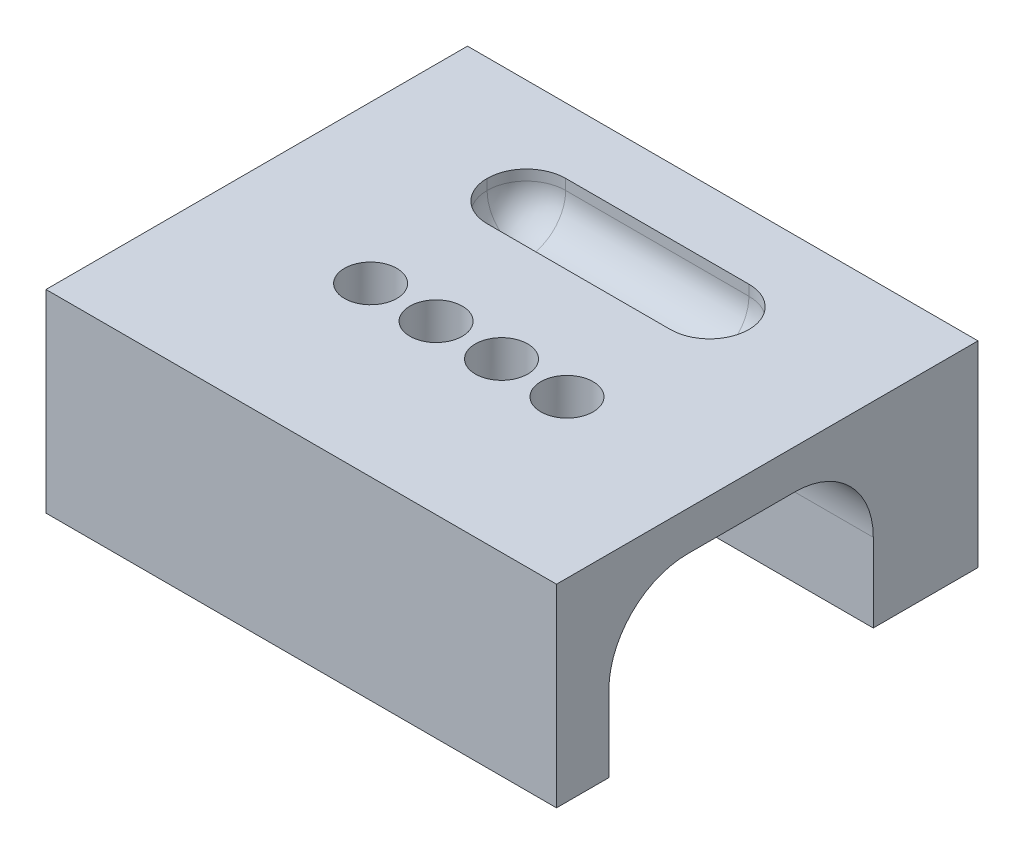
from build123d import *

# Parameters (mm, degrees)
BOSS_EXTRUDE1_DEPTH      = 4.44
BOSS_EXTRUDE1_DEPTH_BACK = 6
SKETCH21_W               = 19.5
SKETCH21_H               = 24
CUT_EXTRUDE2_DEPTH       = 24.71192527
CUT_EXTRUDE2_DEPTH_BACK  = 24.71192527
SKETCH14_R               = 1
CUT_EXTRUDE4_DEPTH       = 23.650882985
CUT_EXTRUDE4_DEPTH_BACK  = 23.650882985
SKETCH20_W               = 31.709739698
SKETCH20_H               = 13.674781638
SKETCH23_W               = 10
SKETCH23_H               = 3
CUT_EXTRUDE5_DEPTH       = 1.9
FILLET1_R                = 1.5
FILLET2_R                = 1.5


with BuildPart() as part:
    # Sketch21 → Boss-Extrude1 (new, two sides: drawn at the far end of the back side and taken through both)
    with BuildSketch(Plane(origin=(0, 0, 0), x_dir=(1, 0, 0), z_dir=(0, 1, 0)).offset(-BOSS_EXTRUDE1_DEPTH_BACK)):
        with Locations((8.5, 0)):
            Rectangle(SKETCH21_W, SKETCH21_H)
    extrude(amount=BOSS_EXTRUDE1_DEPTH + BOSS_EXTRUDE1_DEPTH_BACK)

    # Sketch14 → Cut-Extrude2 (cut, two sides: drawn at the far end of the back side and taken through both)
    with BuildSketch(Plane(origin=(0, 3.23, 0), x_dir=(1, 0, 0), z_dir=(0, 1, 0)).offset(-CUT_EXTRUDE2_DEPTH_BACK)):
        with Locations(Location((4.75, 0, 0), (0, 0, 270))):
            Circle(SKETCH14_R)
        with Locations(Location((7.25, 0, 0), (0, 0, 270))):
            Circle(SKETCH14_R)
        with Locations(Location((9.75, 0, 0), (0, 0, 270))):
            Circle(SKETCH14_R)
        with Locations(Location((12.25, 0, 0), (0, 0, 270))):
            Circle(SKETCH14_R)
    extrude(amount=CUT_EXTRUDE2_DEPTH + CUT_EXTRUDE2_DEPTH_BACK, mode=Mode.SUBTRACT)

    # Sketch20 → Cut-Extrude4 (cut, two sides: drawn at the far end of the back side and taken through both)
    with BuildSketch(Plane(origin=(0, 0, 0), x_dir=(0, 0, -1), z_dir=(1, 0, 0)).offset(-CUT_EXTRUDE4_DEPTH_BACK)):
        with Locations((-0.27698472, -0.290016026)):
            Rectangle(SKETCH20_W, SKETCH20_H)
        with BuildLine():
            Line((-4.4, -0.36), (-4.4, -3.26))
            Line((-4.4, -3.26), (-6.4, -3.26))
            Line((-6.4, -3.26), (-6.4, 4.14))
            Line((-6.4, 4.14), (9.7, 4.14))
            Line((9.7, 4.14), (9.7, -3.36))
            Line((9.7, -3.36), (5.7, -3.36))
            Line((5.7, -3.36), (5.7, -0.36))
            ThreePointArc((5.7, -0.36), (4.821320344, 1.761320344), (2.7, 2.64))
            Line((2.7, 2.64), (0, 2.64))
            Line((0, 2.64), (-1.4, 2.64))
            ThreePointArc((-1.4, 2.64), (-3.521320344, 1.761320344), (-4.4, -0.36))
        make_face(mode=Mode.SUBTRACT)
    extrude(amount=CUT_EXTRUDE4_DEPTH + CUT_EXTRUDE4_DEPTH_BACK, mode=Mode.SUBTRACT)

    # Sketch23 → Cut-Extrude5 (cut)
    with BuildSketch(Plane(origin=(0, 4.14, 0), x_dir=(1, 0, 0), z_dir=(0, 1, 0))):
        with Locations((8.5, 5.7)):
            Rectangle(SKETCH23_W, SKETCH23_H)
    extrude(amount=-CUT_EXTRUDE5_DEPTH, mode=Mode.SUBTRACT)

    # Fillet1
    fillet1_edges = [part.edges().sort_by_distance(p)[0] for p in [
        (8.5, 2.24, -7.2),
        (8.5, 2.24, -4.2),
    ]]
    fillet(fillet1_edges, radius=FILLET1_R - 0.0001)  # a hair under: the kernel refuses the full size

    # Fillet2
    fillet2_edges = [part.edges().sort_by_distance(p)[0] for p in [
        (3.5, 3.93995, -4.2),
        (3.5, 3.93995, -7.2),
        (3.5, 2.679310539, -6.760689461),
        (13.5, 3.93995, -7.2),
        (13.5, 3.93995, -4.2),
        (13.5, 2.679310539, -4.639310539),
        (3.5, 2.679310539, -4.639310539),
        (13.5, 2.679310539, -6.760689461),
    ]]
    fillet(fillet2_edges, radius=FILLET2_R - 0.0001)  # a hair under: the kernel refuses the full size


solid = part.part
